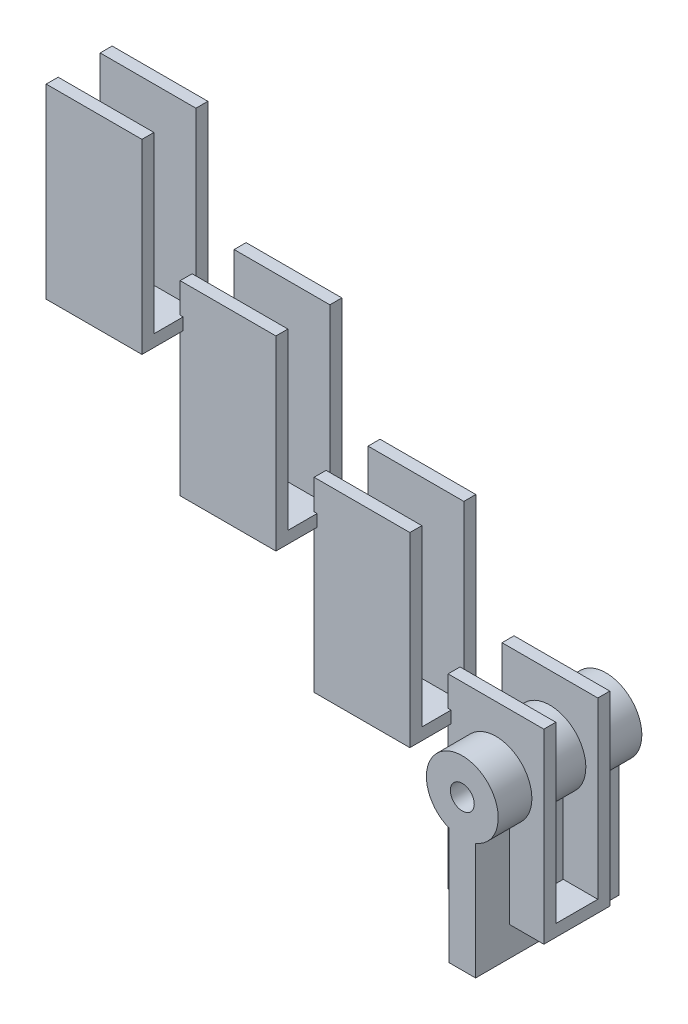
from build123d import *

# Parameters (mm, degrees)
EXTRUDE_5_DEPTH         = 30
EXTRUDE_5_DEPTH_BACK    = 30
F_1_FR_R                = 5
EXTRUDE_6_DEPTH         = 20
EXTRUDE_6_DEPTH_BACK    = 20
MOVE_START              = 130.828771523
MOVE_BODY_2_OUTLINE_W   = 40
MOVE_BODY_2_OUTLINE_H   = 5
MOVE_BODY_2_DEPTH       = 77.833611116
MOVE_BODY_2_2_OUTLINE_W = 40
MOVE_BODY_2_2_OUTLINE_H = 17.543632218
MOVE_BODY_2_2_DEPTH     = 5
MOVE_START_2            = 70.468132412
MOVE_BODY_2_3_OUTLINE_W = 40
MOVE_BODY_2_3_OUTLINE_H = 5
MOVE_BODY_2_3_DEPTH     = 77.833611116
MOVE_BODY_2_4_OUTLINE_W = 40
MOVE_BODY_2_4_OUTLINE_H = 17.543632219
MOVE_BODY_2_4_DEPTH     = 5
MOVE_START_3            = 10.107493301
MOVE_BODY_2_5_OUTLINE_W = 40
MOVE_BODY_2_5_OUTLINE_H = 5
MOVE_BODY_2_5_DEPTH     = 77.833611116
MOVE_BODY_2_6_OUTLINE_W = 40
MOVE_BODY_2_6_OUTLINE_H = 17.543632218
MOVE_BODY_2_6_DEPTH     = 5


# Read off the part's stored shape, not the designer's step: Тело-Переместить/Копировать2
with BuildPart() as part:
    # Эскиз1_fr → Бобышка-Вытянуть5 (new, two sides: drawn at the far end of the back side and taken through both)
    with BuildSketch(Plane.XY.offset(-EXTRUDE_5_DEPTH_BACK)):
        with BuildLine():
            Line((-5.557606452, -13.932444528), (-5.557606452, -62.642280008))
            Line((-5.557606452, -62.642280008), (5.557606452, -62.642280008))
            Line((5.557606452, -62.642280008), (5.557606452, -13.932444528))
            ThreePointArc((5.557606452, -13.932444528), (0, 15), (-5.557606452, -13.932444528))
        make_face()
        Circle(F_1_FR_R, mode=Mode.SUBTRACT)
    extrude(amount=EXTRUDE_5_DEPTH + EXTRUDE_5_DEPTH_BACK)


with BuildPart() as body_2:
    # Эскиз3 → Бобышка-Вытянуть6 (new, two sides: drawn at the far end of the back side and taken through both)
    with BuildSketch(Plane(origin=(0, 0, 0), x_dir=(0, 0, -1), z_dir=(1, 0, 0)).offset(-EXTRUDE_6_DEPTH_BACK)):
        Polygon((-58.394498043, -50.25314581), (-85.938130262, -50.25314581), (-85.938130262, 27.580465306), (-80.938130262, 27.580465306), (-80.938130262, -45.25314581), (-63.394498043, -45.25314581), (-63.394498043, 27.580465306), (-58.394498043, 27.580465306), align=None)
    extrude(amount=EXTRUDE_6_DEPTH + EXTRUDE_6_DEPTH_BACK)


with BuildPart() as body_2_1:
    # Move Body 1: moved
    add(body_2.part.moved(Location((0, 0, -70))))


with BuildPart() as body_3:
    # Move Body 2 outline → Move Body 2 (new body)
    with BuildSketch(Plane(origin=(0, 0, 0), x_dir=(1, 0, 0), z_dir=(0, 1, 0)).offset(MOVE_START)):
        with Locations((-116.225036109, -42.554191316)):
            Rectangle(MOVE_BODY_2_OUTLINE_W, MOVE_BODY_2_OUTLINE_H)
        with Locations((-116.225036109, -65.097823534)):
            Rectangle(MOVE_BODY_2_OUTLINE_W, MOVE_BODY_2_OUTLINE_H)
    extrude(amount=MOVE_BODY_2_DEPTH)

    # Move Body 2 2 outline → Move Body 2 2 (add)
    with BuildSketch(Plane(origin=(0, 0, 0), x_dir=(1, 0, 0), z_dir=(0, 1, 0)).offset(MOVE_START)):
        with Locations((-116.225036109, -53.826007425)):
            Rectangle(MOVE_BODY_2_2_OUTLINE_W, MOVE_BODY_2_2_OUTLINE_H)
    extrude(amount=MOVE_BODY_2_2_DEPTH)


with BuildPart() as body_4:
    # Move Body 2 3 outline → Move Body 2 3 (new body)
    with BuildSketch(Plane(origin=(0, 0, 0), x_dir=(1, 0, 0), z_dir=(0, 1, 0)).offset(MOVE_START_2)):
        with Locations((-77.483357406, -25.334293558)):
            Rectangle(MOVE_BODY_2_3_OUTLINE_W, MOVE_BODY_2_3_OUTLINE_H)
        with Locations((-77.483357406, -47.877925777)):
            Rectangle(MOVE_BODY_2_3_OUTLINE_W, MOVE_BODY_2_3_OUTLINE_H)
    extrude(amount=MOVE_BODY_2_3_DEPTH)

    # Move Body 2 4 outline → Move Body 2 4 (add)
    with BuildSketch(Plane(origin=(0, 0, 0), x_dir=(1, 0, 0), z_dir=(0, 1, 0)).offset(MOVE_START_2)):
        with Locations((-77.483357406, -36.606109668)):
            Rectangle(MOVE_BODY_2_4_OUTLINE_W, MOVE_BODY_2_4_OUTLINE_H)
    extrude(amount=MOVE_BODY_2_4_DEPTH)


with BuildPart() as body_5:
    # Move Body 2 5 outline → Move Body 2 5 (new body)
    with BuildSketch(Plane(origin=(0, 0, 0), x_dir=(1, 0, 0), z_dir=(0, 1, 0)).offset(MOVE_START_3)):
        with Locations((-38.741678703, -8.114395801)):
            Rectangle(MOVE_BODY_2_5_OUTLINE_W, MOVE_BODY_2_5_OUTLINE_H)
        with Locations((-38.741678703, -30.658028019)):
            Rectangle(MOVE_BODY_2_5_OUTLINE_W, MOVE_BODY_2_5_OUTLINE_H)
    extrude(amount=MOVE_BODY_2_5_DEPTH)

    # Move Body 2 6 outline → Move Body 2 6 (add)
    with BuildSketch(Plane(origin=(0, 0, 0), x_dir=(1, 0, 0), z_dir=(0, 1, 0)).offset(MOVE_START_3)):
        with Locations((-38.741678703, -19.38621191)):
            Rectangle(MOVE_BODY_2_6_OUTLINE_W, MOVE_BODY_2_6_OUTLINE_H)
    extrude(amount=MOVE_BODY_2_6_DEPTH)


solid = Compound([part.part, body_2_1.part, body_3.part, body_4.part, body_5.part])
